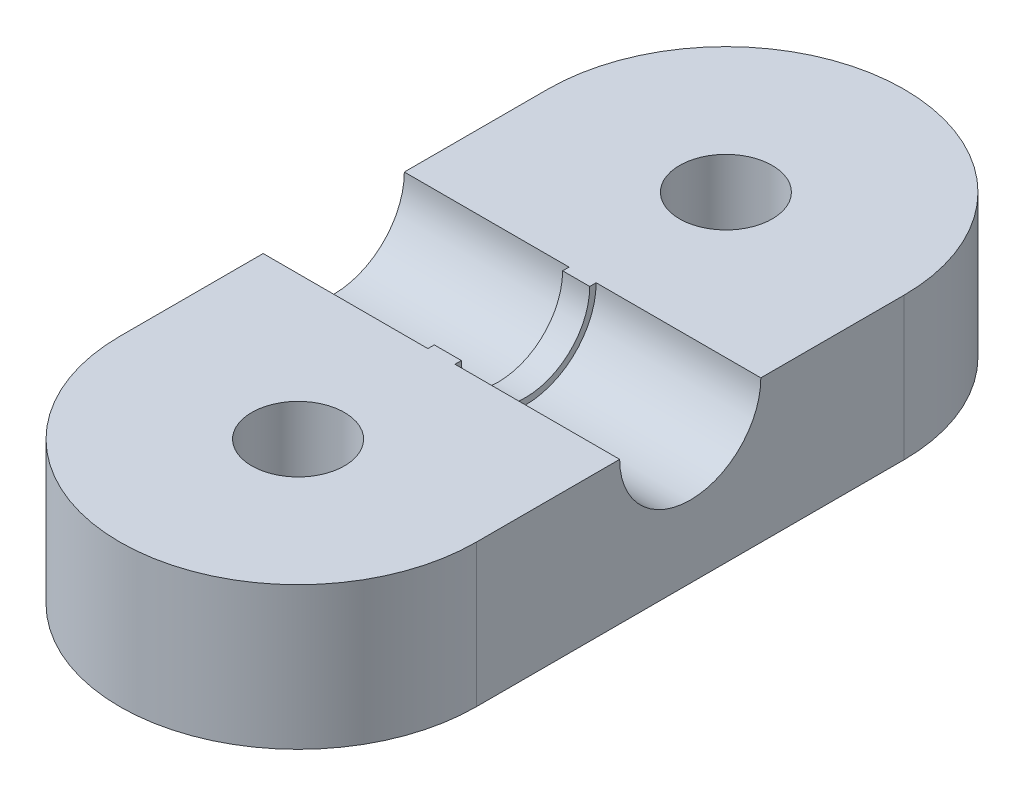
from build123d import *

# Parameters (mm, degrees)
SKETCH1_R           = 3.25
BOSS_EXTRUDE1_DEPTH = 10
CUT_EXTRUDE1_REACH  = 40.487
SKETCH2_R           = 4.95
BOSS_EXTRUDE2_DEPTH = 0.95


with BuildPart() as part:
    # Sketch1 → Boss-Extrude1 (new body)
    with BuildSketch(Plane(origin=(0, 0, 0), x_dir=(1, 0, 0), z_dir=(0, 1, 0))):
        with BuildLine():
            ThreePointArc((12.5, 15), (0, 27.5), (-12.5, 15))
            Line((-12.5, 15), (-12.5, -14.999999966))
            ThreePointArc((-12.5, -14.999999966), (-1.7e-08, -27.5), (12.5, -15))
            Line((12.5, -15), (12.5, 15))
        make_face()
        with Locations((0, 15)):
            Circle(SKETCH1_R, mode=Mode.SUBTRACT)
        with Locations((0, -15)):
            Circle(SKETCH1_R, mode=Mode.SUBTRACT)
    extrude(amount=BOSS_EXTRUDE1_DEPTH)

    # Sketch2 → Cut-Extrude1 (cut, up to next)
    with BuildSketch(Plane(origin=(12.5, 0, 0), x_dir=(0, 0, -1), z_dir=(1, 0, 0)), mode=Mode.PRIVATE) as cut_extrude1_sk1:
        with Locations((0, 10)):
            Circle(SKETCH2_R)
    cut_extrude1_tool1 = extrude(cut_extrude1_sk1.sketch, amount=-CUT_EXTRUDE1_REACH, mode=Mode.PRIVATE) & part.part
    add(cut_extrude1_tool1.solids().sort_by_distance((12.5, 10, 0))[0], mode=Mode.SUBTRACT)

    # Sketch3 → Boss-Extrude2 (add, symmetric)
    with BuildSketch(Plane(origin=(0, 0, 0), x_dir=(0, 0, -1), z_dir=(1, 0, 0))):
        with BuildLine():
            Line((4.95, 10), (4.5, 10))
            ThreePointArc((4.5, 10), (0, 5.5), (-4.5, 10))
            Line((-4.5, 10), (-4.95, 10))
            ThreePointArc((-4.95, 10), (0, 5.05), (4.95, 10))
        make_face()
    extrude(amount=BOSS_EXTRUDE2_DEPTH, both=True)


solid = part.part
